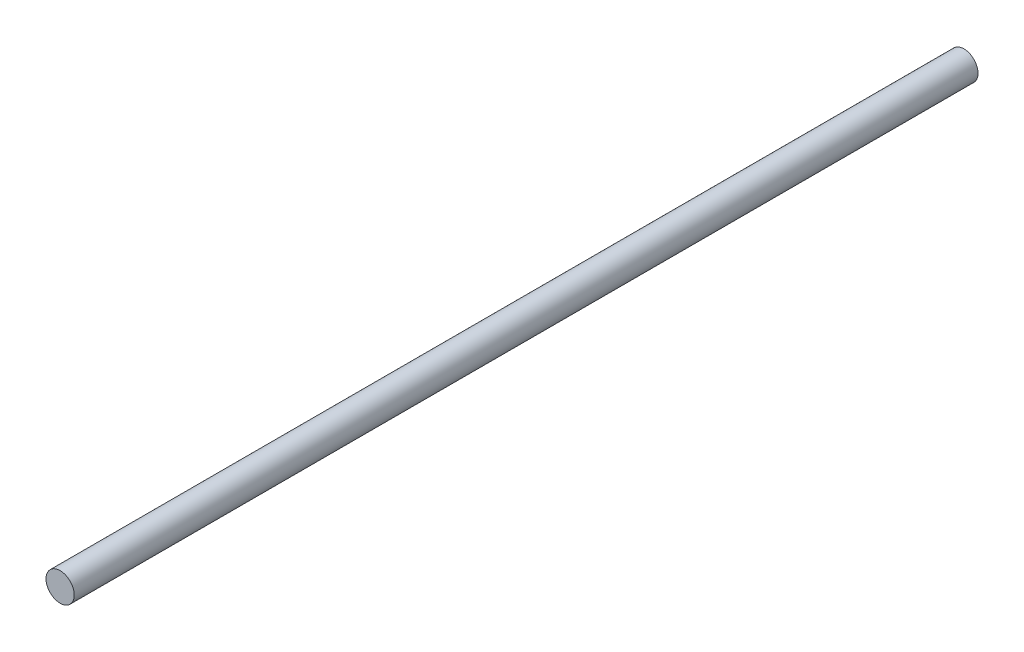
from build123d import *

# Parameters (mm, degrees)
SKETCH2_R           = 4.7625
BOSS_EXTRUDE1_DEPTH = 304.8


with BuildPart() as part:
    # Sketch2 → Boss-Extrude1 (new body)
    with BuildSketch(Plane.XY):
        Circle(SKETCH2_R)
    extrude(amount=BOSS_EXTRUDE1_DEPTH)


solid = part.part
